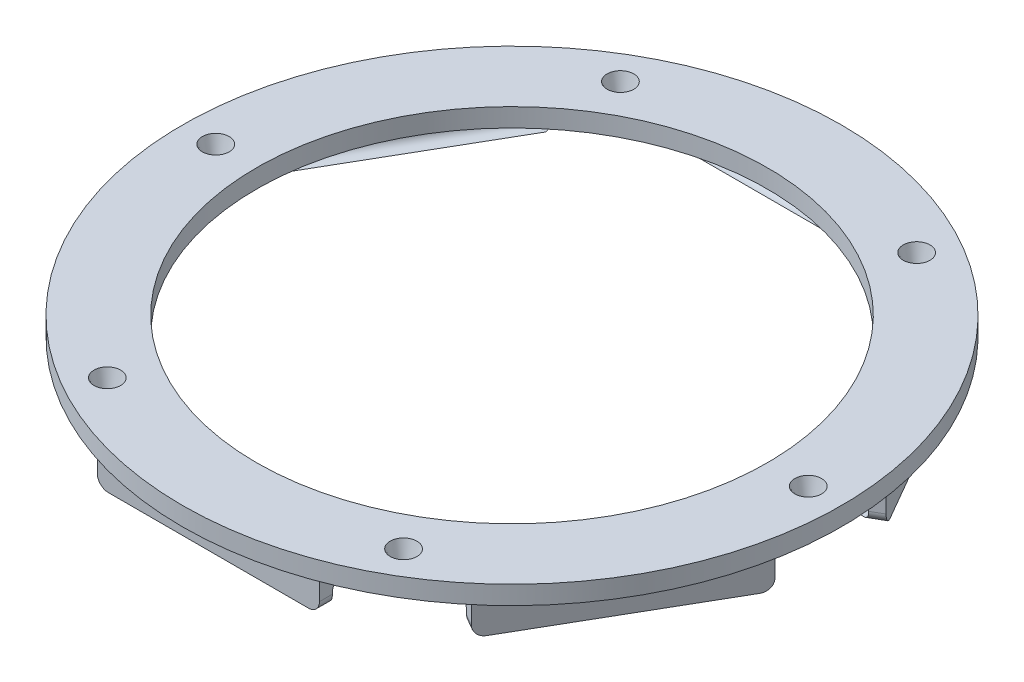
from build123d import *

# Parameters (mm, degrees)
BOSS_EXTRUDE2_START       = -4.5
SKETCH1_W                 = 30
SKETCH1_H                 = 3
BOSS_EXTRUDE2_DEPTH       = 5.5
SKETCH3_R                 = 44.5
SKETCH3_R_2               = 34.5
SKETCH3_R_3               = 1
BOSS_EXTRUDE3_DEPTH       = 2.5
CHAMFER1_SIZE             = 3
CHAMFER1_SIZE_2           = 0.803847577
FILLET1_R                 = 1.5
F_1_0MM_START             = -15
F_1_0MM_DOWEL_SLOT1_DEPTH = 30
CIRPATTERN1_COUNT         = 6
FILLET1_OF_CIRPATTERN1_R  = 1.5


# Read off the part's stored shape, not the designer's step: Ø1.0mm Dowel Slot1
with BuildPart() as part:
    # Sketch1 → Boss-Extrude2 (new body)
    with BuildSketch(Plane(origin=(0, 0, 0), x_dir=(1, 0, 0), z_dir=(0, 1, 0)).offset(BOSS_EXTRUDE2_START)):
        with Locations((0, -39.5)):
            Rectangle(SKETCH1_W, SKETCH1_H)
    boss_extrude2 = extrude(amount=BOSS_EXTRUDE2_DEPTH)

    # Sketch3 → Boss-Extrude3 (add)
    with BuildSketch(Plane(origin=(0, 0, 0), x_dir=(1, 0, 0), z_dir=(0, 1, 0))):
        with Locations(Location((0, 0, 0), (0, 0, 270))):
            Circle(SKETCH3_R)
        with Locations(Location((0, 0, 0), (0, 0, 270))):
            Circle(SKETCH3_R_2, mode=Mode.SUBTRACT)
        with Locations(Location((-20, 34.641016151, 0), (0, 0, 270))):
            Circle(SKETCH3_R_3, mode=Mode.SUBTRACT)
        with Locations(Location((20, 34.641016151, 0), (0, 0, 270))):
            Circle(SKETCH3_R_3, mode=Mode.SUBTRACT)
        with Locations(Location((40, 0, 0), (0, 0, 270))):
            Circle(SKETCH3_R_3, mode=Mode.SUBTRACT)
        with Locations(Location((20, -34.641016151, 0), (0, 0, 270))):
            Circle(SKETCH3_R_3, mode=Mode.SUBTRACT)
        with Locations(Location((-20, -34.641016151, 0), (0, 0, 270))):
            Circle(SKETCH3_R_3, mode=Mode.SUBTRACT)
        with Locations(Location((-40, 0, 0), (0, 0, 270))):
            Circle(SKETCH3_R_3, mode=Mode.SUBTRACT)
    extrude(amount=BOSS_EXTRUDE3_DEPTH)

    # Chamfer1
    # the kernel refuses this chamfer: 3, 0.803847577 mm, written as the material it takes off along each edge
    with BuildSketch(Plane(origin=(20, 2.5, 34.641016151), x_dir=(0, 0, 1), z_dir=(-1, 0, 0))) as chamfer1_piece_1:
        Polygon((1, -CHAMFER1_SIZE), (1 + CHAMFER1_SIZE_2, 0), (1, 0), align=None)
    revolve(axis=Axis((20, 2.5, 34.641016151), (0, 1, 0)), mode=Mode.SUBTRACT)
    with BuildSketch(Plane(origin=(40, 2.5, 0), x_dir=(0, 0, 1), z_dir=(-1, 0, 0))) as chamfer1_piece_2:
        Polygon((1, -CHAMFER1_SIZE), (1 + CHAMFER1_SIZE_2, 0), (1, 0), align=None)
    revolve(axis=Axis((40, 2.5, 0), (0, 1, 0)), mode=Mode.SUBTRACT)
    with BuildSketch(Plane(origin=(20, 2.5, -34.641016151), x_dir=(0, 0, 1), z_dir=(-1, 0, 0))) as chamfer1_piece_3:
        Polygon((1, -CHAMFER1_SIZE), (1 + CHAMFER1_SIZE_2, 0), (1, 0), align=None)
    revolve(axis=Axis((20, 2.5, -34.641016151), (0, 1, 0)), mode=Mode.SUBTRACT)
    with BuildSketch(Plane(origin=(-20, 2.5, -34.641016151), x_dir=(0, 0, 1), z_dir=(-1, 0, 0))) as chamfer1_piece_4:
        Polygon((1, -CHAMFER1_SIZE), (1 + CHAMFER1_SIZE_2, 0), (1, 0), align=None)
    revolve(axis=Axis((-20, 2.5, -34.641016151), (0, 1, 0)), mode=Mode.SUBTRACT)
    with BuildSketch(Plane(origin=(-40, 2.5, 0), x_dir=(0, 0, 1), z_dir=(-1, 0, 0))) as chamfer1_piece_5:
        Polygon((1, -CHAMFER1_SIZE), (1 + CHAMFER1_SIZE_2, 0), (1, 0), align=None)
    revolve(axis=Axis((-40, 2.5, 0), (0, 1, 0)), mode=Mode.SUBTRACT)
    with BuildSketch(Plane(origin=(-20, 2.5, 34.641016151), x_dir=(0, 0, 1), z_dir=(-1, 0, 0))) as chamfer1_piece_6:
        Polygon((1, -CHAMFER1_SIZE), (1 + CHAMFER1_SIZE_2, 0), (1, 0), align=None)
    revolve(axis=Axis((-20, 2.5, 34.641016151), (0, 1, 0)), mode=Mode.SUBTRACT)

    # Fillet1
    fillet1_edges = [part.edges().sort_by_distance(p)[0] for p in [
        (-15, -4.5, 39.5),
        (15, -4.5, 39.5),
    ]]
    fillet(fillet1_edges, radius=FILLET1_R)

    # Ø1.0mm Dowel Slot1 outline → Ø1.0mm Dowel Slot1 (cut)
    with BuildSketch(Plane.YZ.offset(F_1_0MM_START)):
        with BuildLine():
            ThreePointArc((-1.5, 38), (-1.866116524, 38.883883476), (-2.75, 39.25))
            Line((-2.75, 39.25), (-3.25, 39.25))
            ThreePointArc((-3.25, 39.25), (-4.133883476, 38.883883476), (-4.5, 38))
            Line((-4.5, 38), (-1.5, 38))
        make_face()
    f_1_0mm_dowel_slot1 = extrude(amount=F_1_0MM_DOWEL_SLOT1_DEPTH, mode=Mode.SUBTRACT)

    # CirPattern1: Boss-Extrude2, Ø1.0mm Dowel Slot1 ×6 about axis
    cirpattern1_axis = Axis((0, 0, 0), (0, 1, 0))
    add([boss_extrude2.rotate(cirpattern1_axis, i * 360 / CIRPATTERN1_COUNT) for i in range(1, CIRPATTERN1_COUNT)])
    add([f_1_0mm_dowel_slot1.rotate(cirpattern1_axis, i * 360 / CIRPATTERN1_COUNT) for i in range(1, CIRPATTERN1_COUNT)], mode=Mode.SUBTRACT)

    # Fillet1 of CirPattern1
    fillet1_of_cirpattern1_edges = [part.edges().sort_by_distance(p)[0] for p in [
        (26.708003449, -4.5, 32.740381057),
        (41.708003449, -4.5, 6.759618943),
        (41.708003449, -4.5, -6.759618943),
        (26.708003449, -4.5, -32.740381057),
        (15, -4.5, -39.5),
        (-15, -4.5, -39.5),
        (-26.708003449, -4.5, -32.740381057),
        (-41.708003449, -4.5, -6.759618943),
        (-41.708003449, -4.5, 6.759618943),
        (-26.708003449, -4.5, 32.740381057),
    ]]
    fillet(fillet1_of_cirpattern1_edges, radius=FILLET1_OF_CIRPATTERN1_R)


solid = part.part
